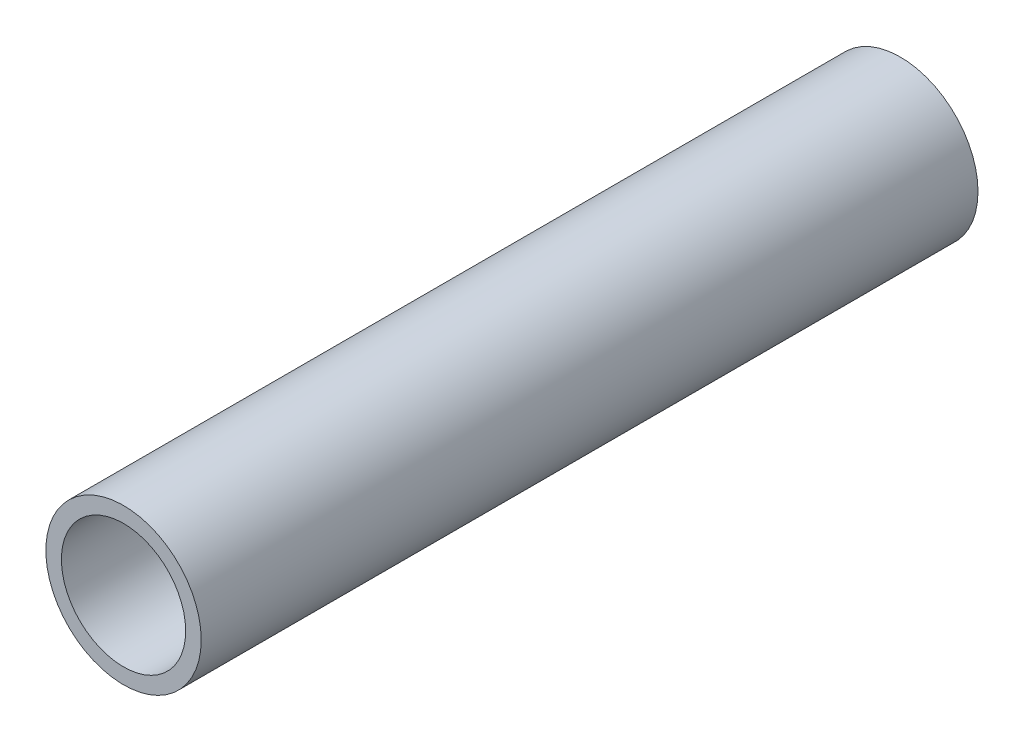
from build123d import *

# Parameters (mm, degrees)
SKETCH1_R           = 20
SKETCH1_R_2         = 16
BOSS_EXTRUDE1_DEPTH = 200


with BuildPart() as part:
    # Sketch1 → Boss-Extrude1 (new body)
    with BuildSketch(Plane.XY):
        Circle(SKETCH1_R)
        Circle(SKETCH1_R_2, mode=Mode.SUBTRACT)
    extrude(amount=BOSS_EXTRUDE1_DEPTH)


solid = part.part
